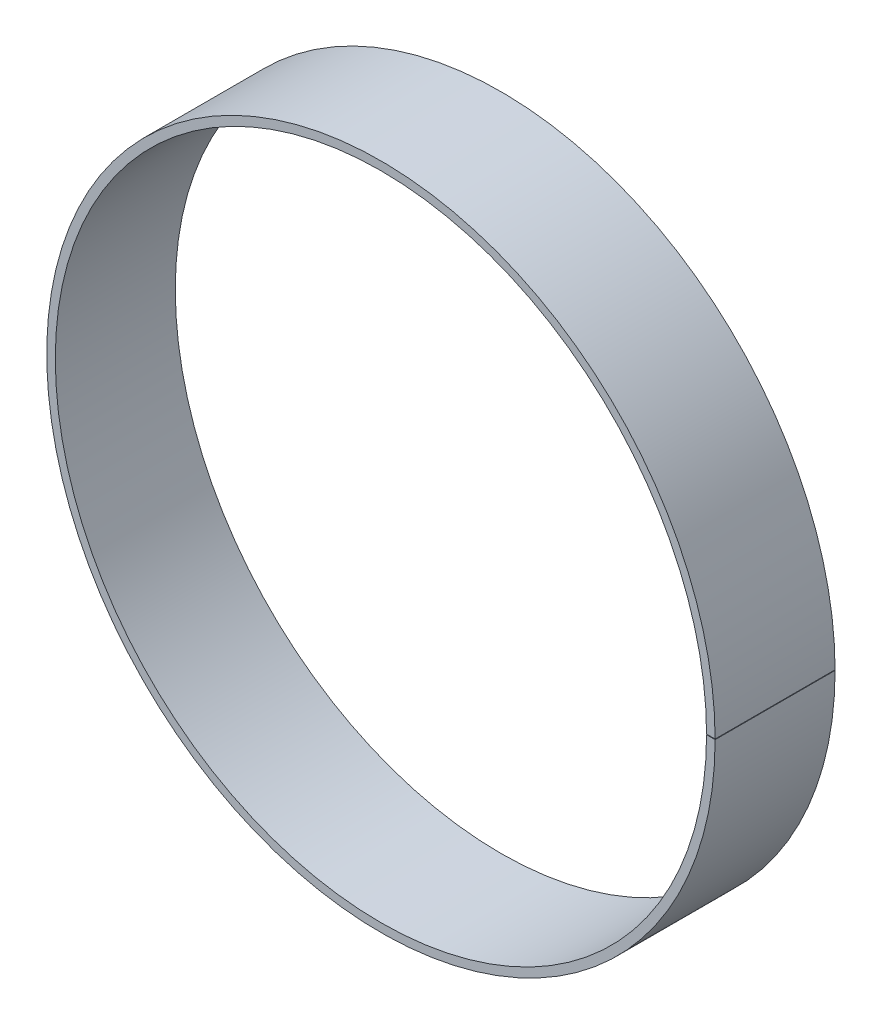
from build123d import *

# Parameters (mm, degrees)
BASE_FLANGE1_DEPTH = 56


# Sheet-metal steps are written as plain solids
with BuildPart() as part:
    # Sketch1 → Base-Flange1 (new body)
    with BuildSketch(Plane.XY):
        with BuildLine():
            ThreePointArc((155.999799679, 0.25), (-155.99994992, -0.12500004), (156, 0))
            Line((156, 0), (152, 0))
            ThreePointArc((152, 0), (-151.999951204, -0.121794911), (151.999804816, 0.243589744))
            Line((151.999804816, 0.243589744), (155.999799679, 0.25))
        make_face()
    extrude(amount=BASE_FLANGE1_DEPTH)


solid = part.part
